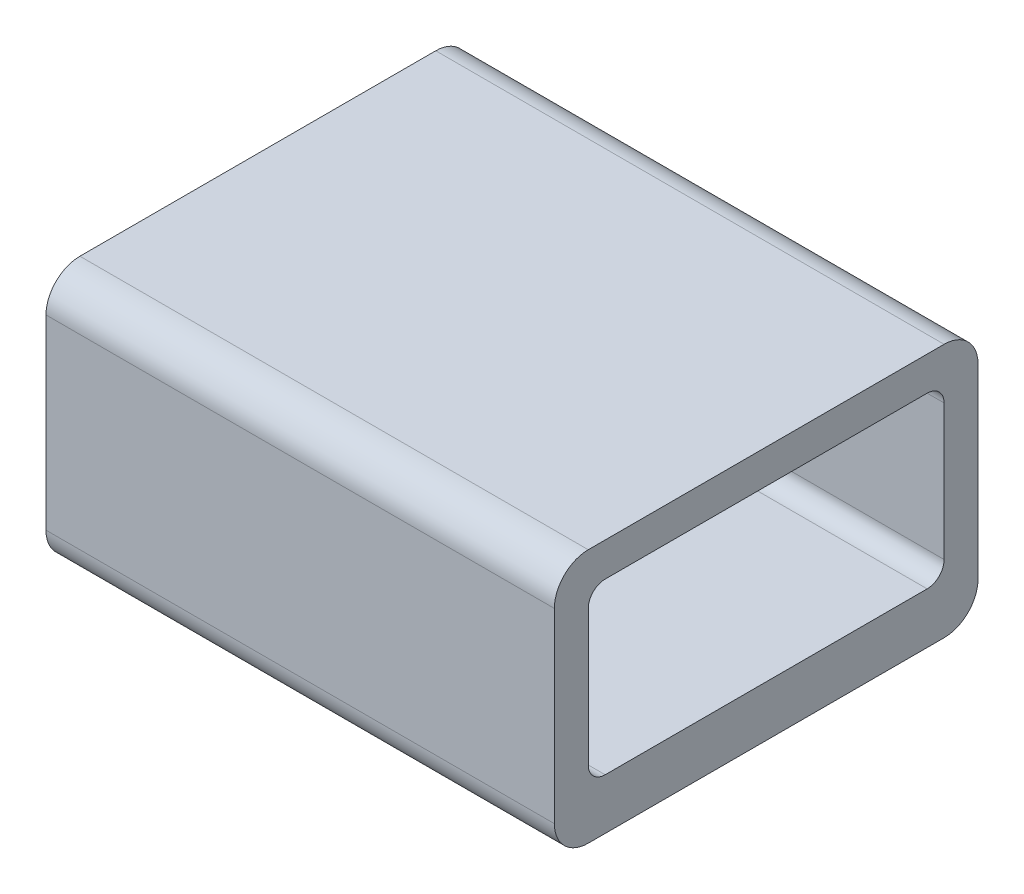
from build123d import *

# Parameters (mm, degrees)
SKETCH1_W           = 25
SKETCH1_H           = 15
BOSS_EXTRUDE1_DEPTH = 30
FILLET1_R           = 2
SHELL1_START        = -10.5
SHELL1_OUTLINE_W    = 30
SHELL1_OUTLINE_H    = 10
SHELL1_DEPTH        = 21
FILLET3_R           = 1


# Read off the part's stored shape, not the designer's step: Shell1
with BuildPart() as part:
    # Sketch1 → Boss-Extrude1 (new body)
    with BuildSketch(Plane(origin=(0, 0, 0), x_dir=(0, 0, -1), z_dir=(1, 0, 0))):
        Rectangle(SKETCH1_W, SKETCH1_H)
    extrude(amount=BOSS_EXTRUDE1_DEPTH)

    # Fillet1
    fillet1_edges = [part.edges().sort_by_distance(p)[0] for p in [
        (15, -7.5, -12.5),
        (15, -7.5, 12.5),
        (15, 7.5, 12.5),
        (15, 7.5, -12.5),
    ]]
    fillet(fillet1_edges, radius=FILLET1_R)

    # Shell1 outline → Shell1 (cut)
    with BuildSketch(Plane.XY.offset(SHELL1_START)):
        with Locations((15, 0.5)):
            Rectangle(SHELL1_OUTLINE_W, SHELL1_OUTLINE_H)
    extrude(amount=SHELL1_DEPTH, mode=Mode.SUBTRACT)

    # Fillet3
    fillet3_edges = [part.edges().sort_by_distance(p)[0] for p in [
        (15, 5.5, -10.5),
        (15, 5.5, 10.5),
        (15, -4.5, 10.5),
        (15, -4.5, -10.5),
    ]]
    fillet(fillet3_edges, radius=FILLET3_R)


solid = part.part
